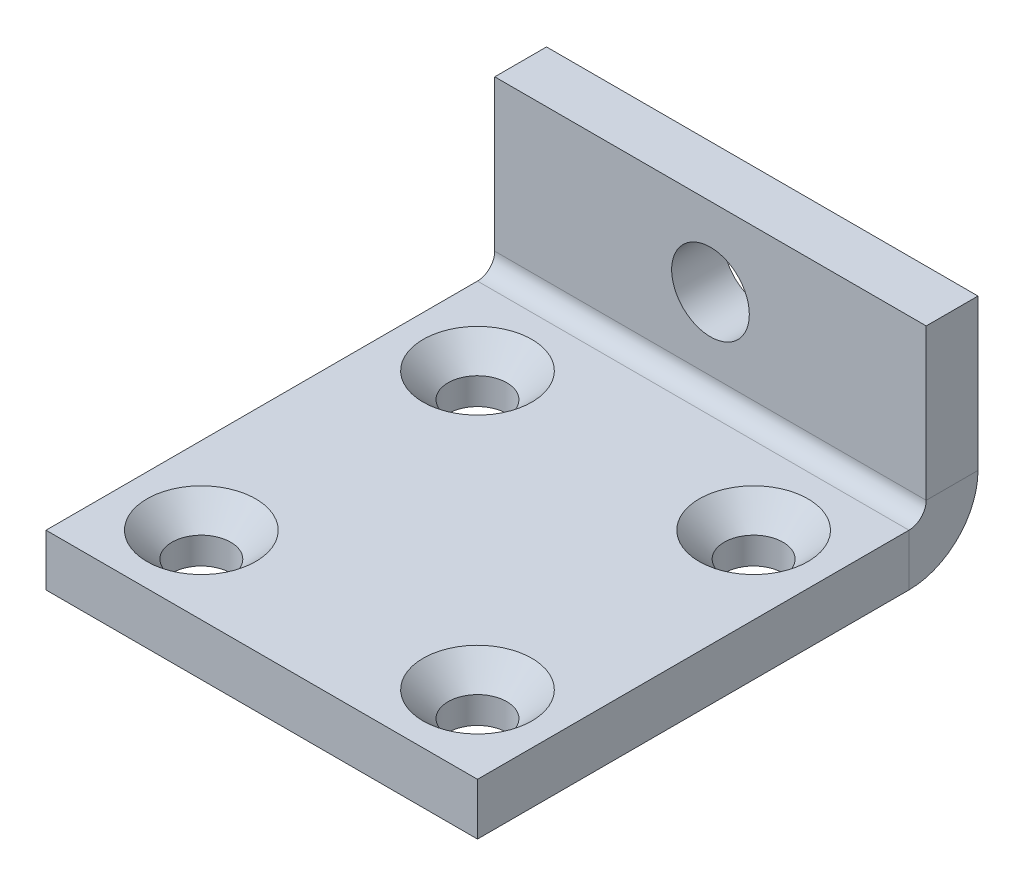
from build123d import *

# Parameters (mm, degrees)
T_LE_DE_BASE_PLI_E1_DEPTH                   = 25
FRAISAGE_POUR_VIS_T_TE_FRAIS_E_M31_AT_COUNT = 2
FRAISAGE_POUR_VIS_T_TE_FRAIS_E_M31_AT_PITCH = 16
FRAISAGE_POUR_VIS_T_TE_FRAIS_E_M31_2_COUNT  = 2
FRAISAGE_POUR_VIS_T_TE_FRAIS_E_M31_2_PITCH  = 22.627416998
FRAISAGE_POUR_VIS_T_TE_FRAIS_E_M31_3_COUNT  = 2
FRAISAGE_POUR_VIS_T_TE_FRAIS_E_M31_3_PITCH  = 16
D_GAGEMENT_M41_D                            = 4.5


# Sheet-metal steps are written as plain solids
with BuildPart() as part:
    # Esquisse1 → Tôle de base pliée1 (new body)
    with BuildSketch(Plane(origin=(0, 0, 0), x_dir=(0, 0, -1), z_dir=(1, 0, 0))):
        with BuildLine():
            Line((0, 12.75), (0, 4))
            ThreePointArc((0, 4), (-1.171572875, 1.171572875), (-4, 0))
            Line((-4, 0), (-29, 0))
            Line((-29, 0), (-29, 3))
            Line((-29, 3), (-4, 3))
            ThreePointArc((-4, 3), (-3.292893219, 3.292893219), (-3, 4))
            Line((-3, 4), (-3, 12.75))
            Line((-3, 12.75), (0, 12.75))
        make_face()
    extrude(amount=T_LE_DE_BASE_PLI_E1_DEPTH)

    # Esquisse7 → Fraisage pour vis à tête fraisée M31 (revolve, cut)
    with BuildSketch(Plane(origin=(4.5, 3, 24.5), x_dir=(0, 0, 1), z_dir=(1, 0, 0))):
        Polygon((0, 0), (0, 3), (1.7, 3), (1.7, 1.45), (3.15, 0), align=None)
    fraisage_pour_vis_t_te_frais_e_m31 = revolve(axis=Axis((4.5, 9.35, 24.5), (0, -1, 0)), mode=Mode.SUBTRACT)

    # Fraisage pour vis à tête fraisée M31 at: Fraisage pour vis à tête fraisée M31 ×2
    with Locations(*[(0, 0, -i * FRAISAGE_POUR_VIS_T_TE_FRAIS_E_M31_AT_PITCH) for i in range(1, FRAISAGE_POUR_VIS_T_TE_FRAIS_E_M31_AT_COUNT)]):
        add(fraisage_pour_vis_t_te_frais_e_m31, mode=Mode.SUBTRACT)

    # Fraisage pour vis _ t_te frais_e M31 2: Fraisage pour vis à tête fraisée M31 ×2
    with Locations(*[Vector(0.7071067811865476, 0, -0.7071067811865476) * (i * FRAISAGE_POUR_VIS_T_TE_FRAIS_E_M31_2_PITCH) for i in range(1, FRAISAGE_POUR_VIS_T_TE_FRAIS_E_M31_2_COUNT)]):
        add(fraisage_pour_vis_t_te_frais_e_m31, mode=Mode.SUBTRACT)

    # Fraisage pour vis _ t_te frais_e M31 3: Fraisage pour vis à tête fraisée M31 ×2
    with Locations(*[(i * FRAISAGE_POUR_VIS_T_TE_FRAIS_E_M31_3_PITCH, 0, 0) for i in range(1, FRAISAGE_POUR_VIS_T_TE_FRAIS_E_M31_3_COUNT)]):
        add(fraisage_pour_vis_t_te_frais_e_m31, mode=Mode.SUBTRACT)

    # Dégagement M41 (through all)
    with Locations(Plane.XY.offset(3)):
        with Locations((12.5, 8.2)):
            Hole(D_GAGEMENT_M41_D / 2)


solid = part.part
